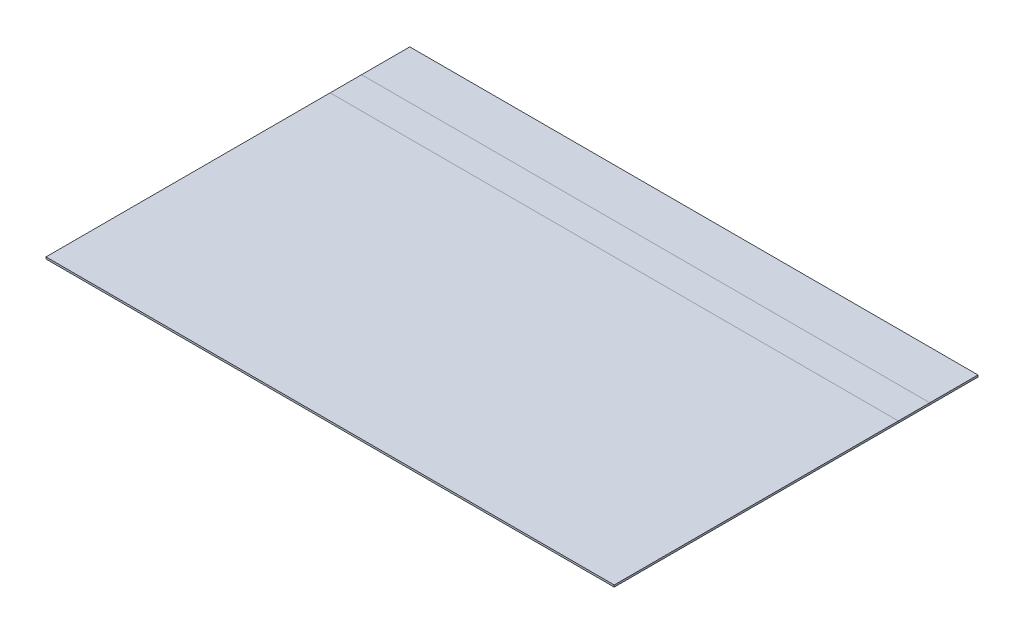
from build123d import *

# Parameters (mm, degrees)
SKETCH3_W          = 300
SKETCH3_H          = 150
BASE_FLANGE1_DEPTH = 1
EDGE_FLANGE2_DEPTH = 300
UNFOLD1_START      = -150
UNFOLD1_DEPTH      = 300
UNFOLD1_2_DEPTH    = 300


# Read off the part's stored shape, not the designer's step: Unfold1
# Sheet-metal steps are written as plain solids
with BuildPart() as part:
    # Sketch3 → Base-Flange1 (new body)
    with BuildSketch(Plane(origin=(0, 0, 0), x_dir=(1, 0, 0), z_dir=(0, 1, 0))):
        Rectangle(SKETCH3_W, SKETCH3_H)
    extrude(amount=-BASE_FLANGE1_DEPTH)

    # Edge-Flange2 section (across the edge) → Edge-Flange2 (add)
    with BuildSketch(Plane(origin=(150, 0, -647.943250647), x_dir=(0, -0.9998476951563913, 0.017452406437283758), z_dir=(-1, 0, 0))):
        with BuildLine():
            Line((-1, 572.943250647), (-1, 598.411349871))
            Line((-1, 598.411349871), (0, 598.411349871))
            Line((0, 598.411349871), (0, 572.943250647))
            ThreePointArc((0, 572.943250647), (4.956367323, 567.943441031), (9.999238476, 572.855988614))
            Line((9.999238476, 572.855988614), (10.999086171, 572.838536208))
            ThreePointArc((10.999086171, 572.838536208), (4.947640787, 566.943479108), (-1, 572.943250647))
        make_face()
    extrude(amount=EDGE_FLANGE2_DEPTH)

    # Unfold1 outline → Unfold1 (cut)
    with BuildSketch(Plane.YZ.offset(UNFOLD1_START)):
        with BuildLine():
            Line((0, -75), (0, -78.31662479))
            ThreePointArc((0, -78.31662479), (6.681854726, -80.759458714), (10.999086171, -75.104714439))
            Line((10.999086171, -75.104714439), (11.44356579, -49.640494129))
            Line((11.44356579, -49.640494129), (10.443718095, -49.623041723))
            Line((10.443718095, -49.623041723), (9.999238476, -75.087262032))
            ThreePointArc((9.999238476, -75.087262032), (4.956367323, -79.999809615), (0, -75))
        make_face()
    extrude(amount=UNFOLD1_DEPTH, mode=Mode.SUBTRACT)

    # Unfold1 2 outline → Unfold1 2 (add)
    with BuildSketch(Plane.YZ.offset(UNFOLD1_START)):
        with BuildLine():
            Line((-1, -75), (-1, -117.057279231))
            Line((-1, -117.057279231), (0, -117.057279231))
            Line((0, -117.057279231), (0, -78.31662479))
            ThreePointArc((0, -78.31662479), (-0.744562646, -76.732050807), (-1, -75))
        make_face()
    extrude(amount=UNFOLD1_2_DEPTH)


solid = part.part
